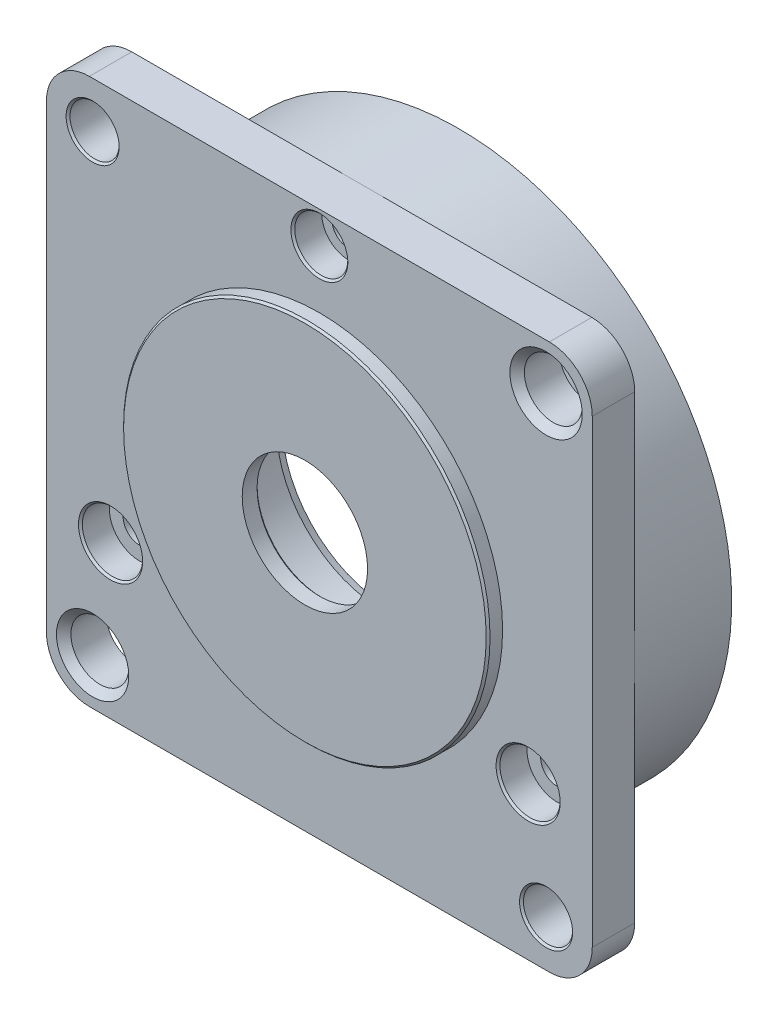
from build123d import *

# Parameters (mm, degrees)
IZIM1_R                     = 2.55
IZIM1_R_2                   = 3
IZIM1_R_3                   = 6.5
IZIM1_R_4                   = 1.7
Y_KSEKLIK_EKSTR_ZYON1_DEPTH = 4.4
IZIM2_R                     = 19
IZIM2_R_2                   = 6.5
Y_KSEKLIK_EKSTR_ZYON2_DEPTH = 1.5
PAH1_SIZE                   = 0.2
PAH2_SIZE                   = 0.75
KES_EKSTR_ZYON1_START       = -3
IZIM3_R                     = 3.125
IZIM3_R_2                   = 1.7
IZIM3_R_3                   = 2.75
KES_EKSTR_ZYON1_DEPTH       = 3
PAH3_SIZE                   = 0.2
IZIM4_R                     = 11
KES_EKSTR_ZYON2_DEPTH       = 3.66
IZIM5_R                     = 8.9
KES_EKSTR_ZYON3_DEPTH       = 0.5
PAH4_SIZE                   = 0.2
Y_KSEKLIK_EKSTR_ZYON3_START = 2.9
IZIM6_R                     = 12.75
IZIM6_R_2                   = 11
Y_KSEKLIK_EKSTR_ZYON3_DEPTH = 2.9
PAH5_SIZE                   = 0.2
PAH5_SIZE2                  = 0.746410162
IZIM7_R                     = 28.3
IZIM7_R_2                   = 26.75
Y_KSEKLIK_EKSTR_ZYON4_DEPTH = 10.06
KES_EKSTR_ZYON4_START       = -0.5
IZIM8_R                     = 12.75
KES_EKSTR_ZYON4_DEPTH       = 0.5
IZIM10_R                    = 27.5
KES_EKSTR_ZYON5_DEPTH       = 1.5


with BuildPart() as part:
    # Çizim1 → Yükseklik-Ekstrüzyon1 (new body)
    with BuildSketch(Plane.XY):
        with BuildLine():
            Line((-23.85, 28.3), (23.85, 28.3))
            ThreePointArc((23.85, 28.3), (26.996625176, 26.996625176), (28.3, 23.85))
            Line((28.3, 23.85), (28.3, -23.85))
            ThreePointArc((28.3, -23.85), (26.996625176, -26.996625176), (23.85, -28.3))
            Line((23.85, -28.3), (-23.85, -28.3))
            ThreePointArc((-23.85, -28.3), (-26.996625176, -26.996625176), (-28.3, -23.85))
            Line((-28.3, -23.85), (-28.3, 23.85))
            ThreePointArc((-28.3, 23.85), (-26.996625176, 26.996625176), (-23.85, 28.3))
        make_face()
        with Locations((-23.511300474, 23.511300474)):
            Circle(IZIM1_R, mode=Mode.SUBTRACT)
        with Locations((23.511300474, -23.511300474)):
            Circle(IZIM1_R, mode=Mode.SUBTRACT)
        with Locations((-23.511300474, -23.511300474)):
            Circle(IZIM1_R_2, mode=Mode.SUBTRACT)
        with Locations((23.511300474, 23.511300474)):
            Circle(IZIM1_R_2, mode=Mode.SUBTRACT)
        Circle(IZIM1_R_3, mode=Mode.SUBTRACT)
        with Locations((0, 25)):
            Circle(IZIM1_R_4, mode=Mode.SUBTRACT)
        with Locations((21.650635095, -12.5)):
            Circle(IZIM1_R_4, mode=Mode.SUBTRACT)
        with Locations((-21.650635095, -12.5)):
            Circle(IZIM1_R_4, mode=Mode.SUBTRACT)
    extrude(amount=Y_KSEKLIK_EKSTR_ZYON1_DEPTH)

    # Çizim2 → Yükseklik-Ekstrüzyon2 (add)
    with BuildSketch(Plane.XY.offset(4.4)):
        Circle(IZIM2_R)
        Circle(IZIM2_R_2, mode=Mode.SUBTRACT)
    extrude(amount=Y_KSEKLIK_EKSTR_ZYON2_DEPTH)

    # Pah1
    pah1_edges = [part.edges().sort_by_distance(p)[0] for p in [
        (-19, 0, 5.9),
    ]]
    chamfer(pah1_edges, length=PAH1_SIZE)

    # Pah2
    pah2_edges = [part.edges().sort_by_distance(p)[0] for p in [
        (20.511300474, 23.511300474, 4.4),
        (-26.511300474, -23.511300474, 4.4),
    ]]
    chamfer(pah2_edges, length=PAH2_SIZE)

    # Çizim3 → Kes-Ekstrüzyon1 (cut)
    # profile 1 of 3: a face of its own
    with BuildSketch(Plane.XY.offset(4.4).offset(KES_EKSTR_ZYON1_START)):
        with Locations((-21.650635095, -12.5)):
            Circle(IZIM3_R)
        with Locations((-21.650635095, -12.5)):
            Circle(IZIM3_R_2, mode=Mode.SUBTRACT)
    # profile 2 of 3: a face of its own
    with BuildSketch(Plane.XY.offset(4.4).offset(KES_EKSTR_ZYON1_START)):
        with Locations((21.650635095, -12.5)):
            Circle(IZIM3_R)
        with Locations((21.650635095, -12.5)):
            Circle(IZIM3_R_2, mode=Mode.SUBTRACT)
    # profile 3 of 3: a face of its own
    with BuildSketch(Plane.XY.offset(4.4).offset(KES_EKSTR_ZYON1_START)):
        with Locations((0, 25)):
            Circle(IZIM3_R_3)
        with Locations((0, 25)):
            Circle(IZIM3_R_2, mode=Mode.SUBTRACT)
    extrude(amount=KES_EKSTR_ZYON1_DEPTH, mode=Mode.SUBTRACT)

    # Pah3
    pah3_edges = [part.edges().sort_by_distance(p)[0] for p in [
        (20.961300474, -23.511300474, 4.4),
        (-26.061300474, 23.511300474, 4.4),
        (-2.75, 25, 4.4),
        (-24.775635095, -12.5, 4.4),
        (18.525635095, -12.5, 4.4),
    ]]
    chamfer(pah3_edges, length=PAH3_SIZE)

    # Çizim4 → Kes-Ekstrüzyon2 (cut)
    with BuildSketch(Plane(origin=(0, 0, 0), x_dir=(-1, 0, 0), z_dir=(0, 0, -1))):
        Circle(IZIM4_R)
    extrude(amount=-KES_EKSTR_ZYON2_DEPTH, mode=Mode.SUBTRACT)

    # Çizim5 → Kes-Ekstrüzyon3 (cut)
    with BuildSketch(Plane(origin=(0, 0, 3.66), x_dir=(-1, 0, 0), z_dir=(0, 0, -1))):
        Circle(IZIM5_R)
    extrude(amount=-KES_EKSTR_ZYON3_DEPTH, mode=Mode.SUBTRACT)

    # Pah4
    pah4_edges = [part.edges().sort_by_distance(p)[0] for p in [
        (-6.5, 0, 4.16),
    ]]
    chamfer(pah4_edges, length=PAH4_SIZE)

    # Çizim6 → Yükseklik-Ekstrüzyon3 (add)
    with BuildSketch(Plane(origin=(0, 0, 0), x_dir=(-1, 0, 0), z_dir=(0, 0, -1)).offset(Y_KSEKLIK_EKSTR_ZYON3_START)):
        Circle(IZIM6_R)
        Circle(IZIM6_R_2, mode=Mode.SUBTRACT)
    extrude(amount=-Y_KSEKLIK_EKSTR_ZYON3_DEPTH)

    # Pah5
    pah5_edges = [part.edges().sort_by_distance(p)[0] for p in [
        (11, 0, -2.9),
    ]]
    pah5_side = [part.faces().sort_by_distance(p)[0] for p in [
        (12.389375542, 0, -2.9),
    ]]
    chamfer(pah5_edges, length=PAH5_SIZE, length2=PAH5_SIZE2, reference=pah5_side[0])

    # Çizim7 → Yükseklik-Ekstrüzyon4 (add)
    with BuildSketch(Plane(origin=(0, 0, 0), x_dir=(-1, 0, 0), z_dir=(0, 0, -1))):
        Circle(IZIM7_R)
        Circle(IZIM7_R_2, mode=Mode.SUBTRACT)
    extrude(amount=Y_KSEKLIK_EKSTR_ZYON4_DEPTH)

    # Çizim8 → Kes-Ekstrüzyon4 (cut)
    with BuildSketch(Plane(origin=(0, 0, 0), x_dir=(-1, 0, 0), z_dir=(0, 0, -1)).offset(KES_EKSTR_ZYON4_START)):
        with BuildLine():
            Line((-2.9, 25), (-2.9, 26.592339122))
            ThreePointArc((-2.9, 26.592339122), (-23.166179551, 13.375), (-24.479641226, -10.78469589))
            Line((-24.479641226, -10.78469589), (-23.100635095, -9.988526329))
            ThreePointArc((-23.100635095, -9.988526329), (-19.139161424, -11.05), (-20.200635095, -15.011473671))
            Line((-20.200635095, -15.011473671), (-21.579641226, -15.807643232))
            ThreePointArc((-21.579641226, -15.807643232), (0, -26.75), (21.579641226, -15.807643232))
            Line((21.579641226, -15.807643232), (20.200635095, -15.011473671))
            ThreePointArc((20.200635095, -15.011473671), (19.139161424, -11.05), (23.100635095, -9.988526329))
            Line((23.100635095, -9.988526329), (24.479641226, -10.78469589))
            ThreePointArc((24.479641226, -10.78469589), (23.166179551, 13.375), (2.9, 26.592339122))
            Line((2.9, 26.592339122), (2.9, 25))
            ThreePointArc((2.9, 25), (0, 22.1), (-2.9, 25))
        make_face()
        Circle(IZIM8_R, mode=Mode.SUBTRACT)
    extrude(amount=KES_EKSTR_ZYON4_DEPTH, mode=Mode.SUBTRACT)

    # Çizim10 → Kes-Ekstrüzyon5 (cut)
    with BuildSketch(Plane(origin=(0, 0, -10.06), x_dir=(-1, 0, 0), z_dir=(0, 0, -1))):
        Circle(IZIM10_R)
    extrude(amount=-KES_EKSTR_ZYON5_DEPTH, mode=Mode.SUBTRACT)


solid = part.part
